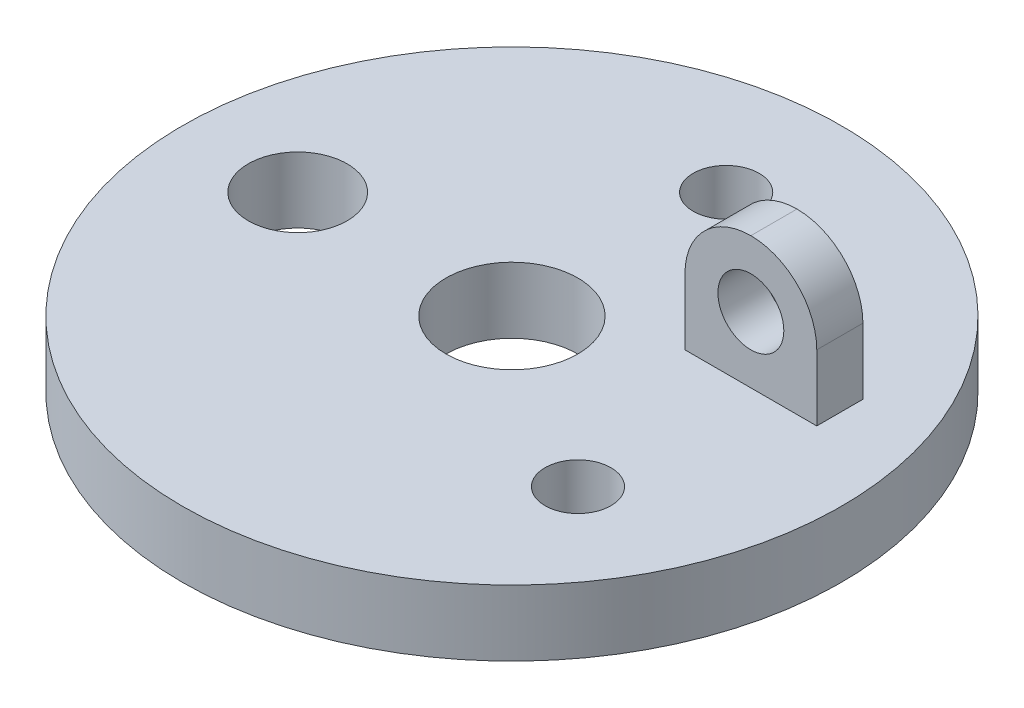
from build123d import *

# Parameters (mm, degrees)
SKETCH1_R           = 50
SKETCH1_R_2         = 5
SKETCH1_R_3         = 7.5
SKETCH1_R_4         = 10
BOSS_EXTRUDE1_DEPTH = 5
SKETCH2_W           = 20
SKETCH2_H           = 7
BOSS_EXTRUDE2_DEPTH = 20
FILLET1_R           = 10
SKETCH3_R           = 5
CUT_EXTRUDE1_DEPTH  = 82.04221019


with BuildPart() as part:
    # Sketch1 → Boss-Extrude1 (new, symmetric)
    with BuildSketch(Plane(origin=(0, 0, 0), x_dir=(1, 0, 0), z_dir=(0, 1, 0))):
        with Locations(Location((0, 0, 0), (0, 0, 270))):
            Circle(SKETCH1_R)
        with Locations(Location((27.43826166, -17.418145627, 0), (0, 0, 270))):
            Circle(SKETCH1_R_2, mode=Mode.SUBTRACT)
        with Locations(Location((-32.5, 0, 0), (0, 0, 270))):
            Circle(SKETCH1_R_3, mode=Mode.SUBTRACT)
        with Locations(Location((0, 32.5, 0), (0, 0, 270))):
            Circle(SKETCH1_R_2, mode=Mode.SUBTRACT)
        with Locations(Location((0, 0, 0), (0, 0, 270))):
            Circle(SKETCH1_R_4, mode=Mode.SUBTRACT)
    extrude(amount=BOSS_EXTRUDE1_DEPTH, both=True)

    # Sketch2 → Boss-Extrude2 (add)
    with BuildSketch(Plane(origin=(0, 5, 0), x_dir=(1, 0, 0), z_dir=(0, 1, 0))):
        with Locations((27.570975848, 12.175717572)):
            Rectangle(SKETCH2_W, SKETCH2_H)
    extrude(amount=BOSS_EXTRUDE2_DEPTH)

    # Fillet1
    fillet1_edges = [part.edges().sort_by_distance(p)[0] for p in [
        (17.570975848, 25, -12.175717572),
        (37.570975848, 25, -12.175717572),
    ]]
    fillet(fillet1_edges, radius=FILLET1_R - 0.0001)  # a hair under: the kernel refuses the full size

    # Sketch3 → Cut-Extrude1 (cut, through all)
    with BuildSketch(Plane.XY.offset(-8.675717572)):
        with Locations((27.570975848, 15)):
            Circle(SKETCH3_R)
    extrude(amount=-CUT_EXTRUDE1_DEPTH, mode=Mode.SUBTRACT)


solid = part.part
